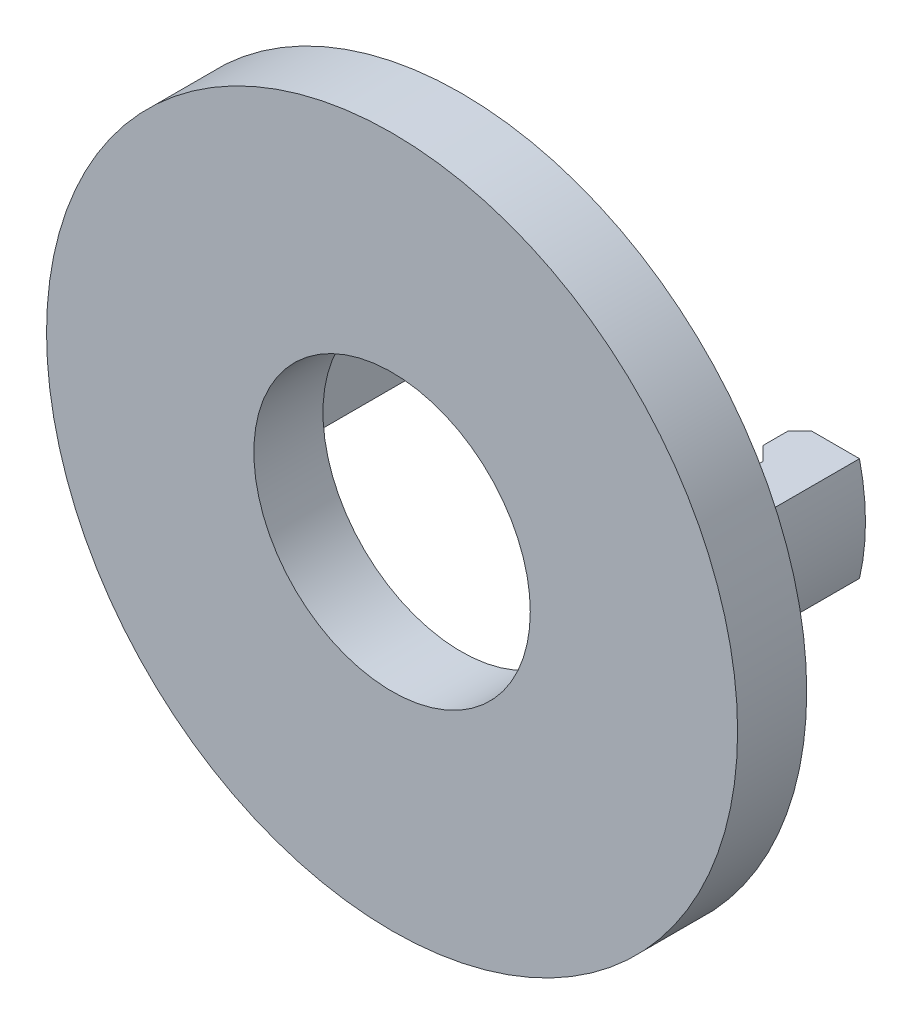
from build123d import *

# Parameters (mm, degrees)
GUARD_BASE_R           = 25
GUARD_DEPTH            = 5
INNER_AXLE_HOLE_BASE_R = 10
INNER_AXLE_HOLE_DEPTH  = 36.707142143
COUPLING_TOOTH_DEPTH   = 3.75
SKETCH6_4_W            = 8.5
SKETCH6_4_H            = 12.75


with BuildPart() as part:
    # Guard base → Guard (new body)
    with BuildSketch(Plane.XY):
        Circle(GUARD_BASE_R)
    extrude(amount=GUARD_DEPTH)

    # Inner axle hole base → Inner axle hole (cut, through all)
    with BuildSketch(Plane.XY.offset(5)):
        Circle(INNER_AXLE_HOLE_BASE_R)
    extrude(amount=-INNER_AXLE_HOLE_DEPTH, mode=Mode.SUBTRACT)

    # Coupling tooth base → Coupling tooth (add, symmetric)
    with BuildSketch(Plane(origin=(0, 0, 0), x_dir=(1, 0, 0), z_dir=(0, 1, 0))):
        Polygon((10.353553391, 0), (16.5, 0), (16.5, 12.75), (12.603553391, 12.75), (11.75, 11.896446609), (11.75, 10.103553391), (12.75, 9.103553391), (12.75, 2.396446609), align=None)
    coupling_tooth = extrude(amount=COUPLING_TOOTH_DEPTH, both=True)

    # Sketch6<4> → Circularity cut (revolve, cut)
    with BuildSketch(Plane(origin=(0, 0, 0), x_dir=(1, 0, 0), z_dir=(0, 1, 0))):
        with Locations((20.75, 6.375)):
            Rectangle(SKETCH6_4_W, SKETCH6_4_H)
    circularity_cut = revolve(axis=Axis((0, 0, 0), (0, 0, -1)), mode=Mode.SUBTRACT)

    # Coutpling teeth: Coupling tooth, Circularity cut across plane
    add(coupling_tooth.mirror(Plane(origin=(0, 0, 0), x_dir=(0, 0, 1), z_dir=(1, 0, 0))))
    add(circularity_cut.mirror(Plane(origin=(0, 0, 0), x_dir=(0, 0, 1), z_dir=(1, 0, 0))), mode=Mode.SUBTRACT)


solid = part.part
